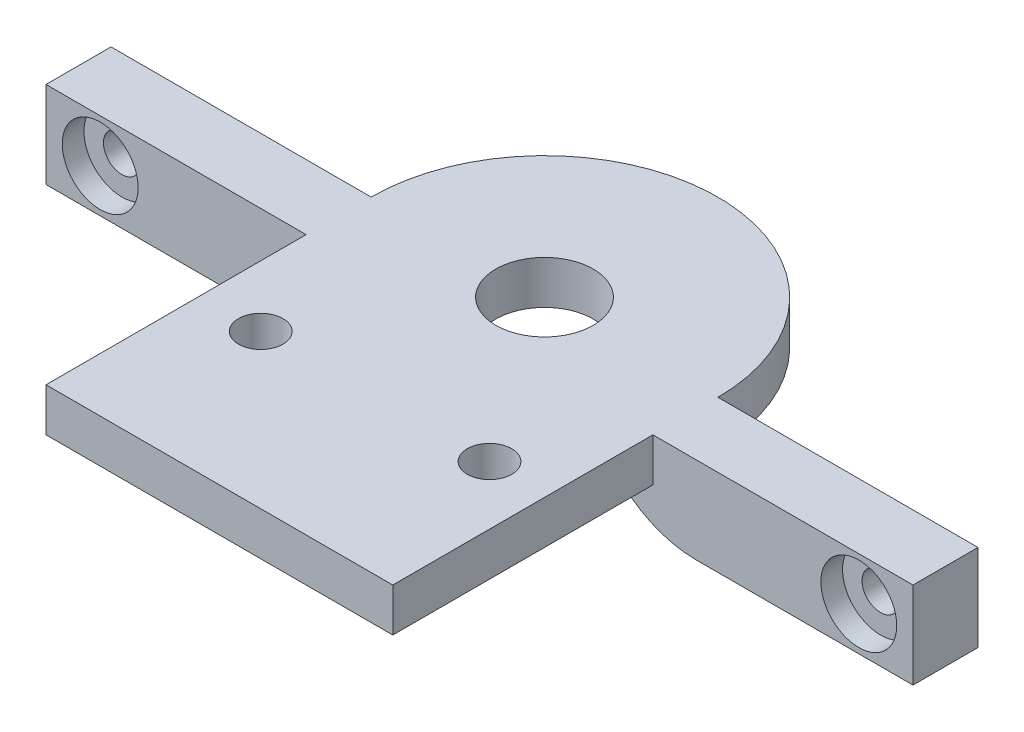
from build123d import *

# Parameters (mm, degrees)
SKETCH1_R                                            = 4.5
BOSS_EXTRUDE1_DEPTH                                  = 4
SKETCH2_W                                            = 24
SKETCH2_H                                            = 6
BOSS_EXTRUDE2_DEPTH                                  = 8
CBORE_FOR_M3_HEXAGON_HEAD_BOLTS_FULL_THR_D           = 3.4
CBORE_FOR_M3_HEXAGON_HEAD_BOLTS_FULL_THR_CBORE_D     = 7
CBORE_FOR_M3_HEXAGON_HEAD_BOLTS_FULL_THR_CBORE_DEPTH = 2
FILLET1_R                                            = 10
FILLET2_R                                            = 10
SKETCH4_R                                            = 2.05
SKETCH4_R_2                                          = 1.9812
CUT_EXTRUDE2_DEPTH                                   = 51.635955605


with BuildPart() as part:
    # Sketch1 → Boss-Extrude1 (new body)
    with BuildSketch(Plane(origin=(0, 0, 0), x_dir=(1, 0, 0), z_dir=(0, 1, 0))):
        with BuildLine():
            Line((-16, 0), (-16, -30))
            Line((-16, -30), (16, -30))
            Line((16, -30), (16, 0))
            ThreePointArc((16, 0), (0, 16), (-16, 0))
        make_face()
        with Locations(Location((0, 0, 0), (0, 0, 270))):
            Circle(SKETCH1_R, mode=Mode.SUBTRACT)
    extrude(amount=BOSS_EXTRUDE1_DEPTH)

    # Sketch2 → Boss-Extrude2 (add)
    with BuildSketch(Plane(origin=(0, 4, 0), x_dir=(1, 0, 0), z_dir=(0, 1, 0))):
        with Locations((28, -3)):
            Rectangle(SKETCH2_W, SKETCH2_H)
        with Locations((-28, -3)):
            Rectangle(SKETCH2_W, SKETCH2_H)
    extrude(amount=-BOSS_EXTRUDE2_DEPTH)

    # CBORE for M3 Hexagon head bolts-Full thread-grades AB1 (through all)
    with Locations(Plane(origin=(-35, 0, 6), x_dir=(1, 0, 0), z_dir=(0, 0, 1))):
        with Locations((0, 0), (70, 0)):
            CounterBoreHole(CBORE_FOR_M3_HEXAGON_HEAD_BOLTS_FULL_THR_D / 2, CBORE_FOR_M3_HEXAGON_HEAD_BOLTS_FULL_THR_CBORE_D / 2, CBORE_FOR_M3_HEXAGON_HEAD_BOLTS_FULL_THR_CBORE_DEPTH)

    # Fillet1
    # the kernel refuses this fillet: 10 mm, written as the material it adds along each edge
    with BuildSketch(Plane(origin=(16, 0, 6), x_dir=(-1, 0, 0), z_dir=(0, 0, -1)), Plane(origin=(-16, 0, 0), x_dir=(1, 0, 0), z_dir=(0, 0, 1))) as fillet1_piece_1:
        with BuildLine():
            CenterArc((8, -10), FILLET1_R, 90, 53.130102354)
            Line((0, -4), (0, 0))
            Line((0, 0), (8, 0))
        make_face()
    extrude(amount=6)

    # Fillet2
    fillet2_edges = [part.edges().sort_by_distance(p)[0] for p in [
        (16, -4, 3),
        (-16, -4, 3),
    ]]
    fillet(fillet2_edges, radius=FILLET2_R)

    # Sketch4 → Cut-Extrude2 (cut, through all)
    # profile 1 of 4: a face of its own
    with BuildSketch(Plane(origin=(0, 4, 0), x_dir=(1, 0, 0), z_dir=(0, 1, 0))):
        with Locations(Location((-10.359727729, -15.825724364, 0), (0, 0, 270))):
            Circle(SKETCH4_R)
        with Locations((-10.359727729, -15.825724364)):
            Circle(SKETCH4_R_2, mode=Mode.SUBTRACT)
    # profile 2 of 4: a face of its own
    with BuildSketch(Plane(origin=(0, 4, 0), x_dir=(1, 0, 0), z_dir=(0, 1, 0))):
        with Locations((-10.359727729, -15.825724364)):
            Circle(SKETCH4_R_2)
    # profile 3 of 4: a face of its own
    with BuildSketch(Plane(origin=(0, 4, 0), x_dir=(1, 0, 0), z_dir=(0, 1, 0))):
        with Locations(Location((10.594689167, -15.669399213, 0), (0, 0, 270))):
            Circle(SKETCH4_R)
        with Locations((10.594689167, -15.669399213)):
            Circle(SKETCH4_R_2, mode=Mode.SUBTRACT)
    # profile 4 of 4: a face of its own
    with BuildSketch(Plane(origin=(0, 4, 0), x_dir=(1, 0, 0), z_dir=(0, 1, 0))):
        with Locations((10.594689167, -15.669399213)):
            Circle(SKETCH4_R_2)
    extrude(amount=-CUT_EXTRUDE2_DEPTH, mode=Mode.SUBTRACT)


solid = part.part
